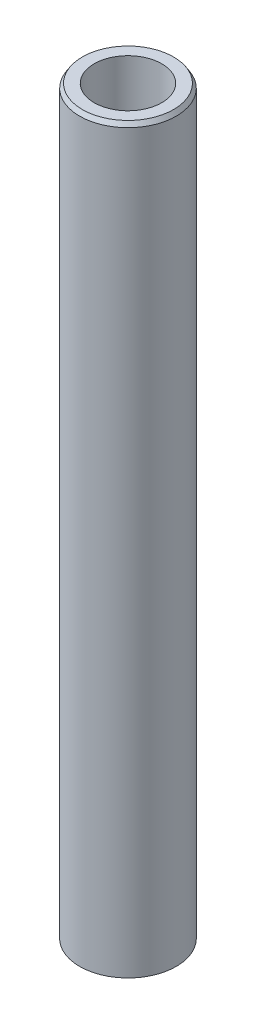
from build123d import *
from OCP.BRepFilletAPI import BRepFilletAPI_MakeChamfer

# Parameters (mm, degrees)
SKETCH1_R           = 25
BOSS_EXTRUDE1_DEPTH = 384.552550563
SKETCH2_R           = 17.47358736
CUT_EXTRUDE1_DEPTH  = 387.174396024
CHAMFER1_SIZE       = 2.247456245
CHAMFER1_SIZE2      = 1.410855187


with BuildPart() as part:
    # Sketch1 → Boss-Extrude1 (new body)
    with BuildSketch(Plane(origin=(0, 0, 0), x_dir=(1, 0, 0), z_dir=(0, 1, 0))):
        Circle(SKETCH1_R)
    extrude(amount=BOSS_EXTRUDE1_DEPTH)

    # Sketch2 → Cut-Extrude1 (cut, through all)
    with BuildSketch(Plane(origin=(0, 0, 0), x_dir=(1, 0, 0), z_dir=(0, 1, 0))):
        Circle(SKETCH2_R)
    extrude(amount=CUT_EXTRUDE1_DEPTH, mode=Mode.SUBTRACT)

    # Chamfer1: one chamfer whose edges measure the first distance from different faces: ONE call of the kernel's chamfer builder (chamfer() names one face for all edges)
    chamfer1_edges_1 = [part.edges().sort_by_distance(p)[0] for p in [
        (-25, 384.552550563, 0),
    ]]
    chamfer1_side_1 = [part.faces().sort_by_distance(p)[0] for p in [
        (-25, 192.276275281, 0),
    ]]
    chamfer1_edges_2 = [part.edges().sort_by_distance(p)[0] for p in [
        (-25, 0, 0),
    ]]
    chamfer1_side_2 = [part.faces().sort_by_distance(p)[0] for p in [
        (-24.292893219, 0, 0),
    ]]
    chamfer1 = BRepFilletAPI_MakeChamfer(part.part.solid().wrapped)
    for e in chamfer1_edges_1:
        chamfer1.Add(CHAMFER1_SIZE, CHAMFER1_SIZE2, e.wrapped, chamfer1_side_1[0].wrapped)  # the first distance lies on this face
    for e in chamfer1_edges_2:
        chamfer1.Add(CHAMFER1_SIZE, CHAMFER1_SIZE2, e.wrapped, chamfer1_side_2[0].wrapped)  # the first distance lies on this face
    add(Compound.cast(chamfer1.Shape()), mode=Mode.REPLACE)


solid = part.part
